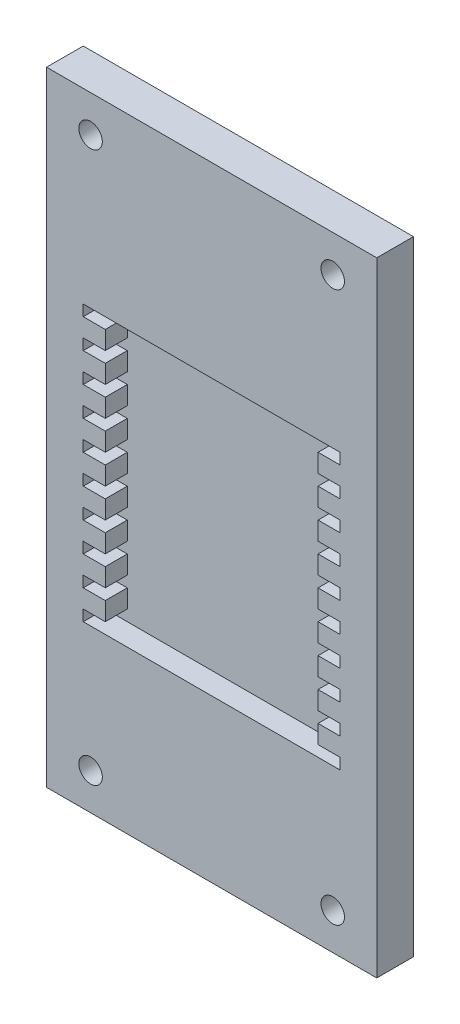
from build123d import *

# Parameters (mm, degrees)
SKIZZE1_W                       = 45
SKIZZE1_H                       = 85
AUFSATZ_LINEAR_AUSTRAGEN1_DEPTH = 5
SKIZZE6_R                       = 1.6
SCHNITT_LINEAR_AUSTRAGEN2_DEPTH = 3
SKIZZE7_W                       = 35
SKIZZE7_H                       = 1.5
SCHNITT_LINEAR_AUSTRAGEN3_DEPTH = 10
SKIZZE8_W                       = 29
SKIZZE8_H                       = 37.5
SCHNITT_LINEAR_AUSTRAGEN4_DEPTH = 10
SKIZZE9_W                       = 38.051320542
SKIZZE9_H                       = 40.768170305
AUFSATZ_LINEAR_AUSTRAGEN2_DEPTH = 2


with BuildPart() as part:
    # Skizze1 → Aufsatz-Linear austragen1 (new body)
    with BuildSketch(Plane.XY):
        with Locations((22.5, 42.5)):
            Rectangle(SKIZZE1_W, SKIZZE1_H)
    extrude(amount=AUFSATZ_LINEAR_AUSTRAGEN1_DEPTH)

    # Skizze6 → Schnitt-Linear austragen2 (cut)
    with BuildSketch(Plane.XY.offset(5)):
        with Locations((6, 80)):
            Circle(SKIZZE6_R)
        with Locations((39, 80)):
            Circle(SKIZZE6_R)
        with Locations((39, 5)):
            Circle(SKIZZE6_R)
        with Locations((6, 5)):
            Circle(SKIZZE6_R)
    extrude(amount=-SCHNITT_LINEAR_AUSTRAGEN2_DEPTH, mode=Mode.SUBTRACT)

    # Skizze7 → Schnitt-Linear austragen3 (cut)
    with BuildSketch(Plane.XY.offset(5)):
        with Locations((22.5, 58.8)):
            Rectangle(SKIZZE7_W, SKIZZE7_H)
        with Locations((22.5, 54.8)):
            Rectangle(SKIZZE7_W, SKIZZE7_H)
        with Locations((22.5, 50.8)):
            Rectangle(SKIZZE7_W, SKIZZE7_H)
        with Locations((22.5, 46.8)):
            Rectangle(SKIZZE7_W, SKIZZE7_H)
        with Locations((22.5, 42.8)):
            Rectangle(SKIZZE7_W, SKIZZE7_H)
        with Locations((22.5, 38.8)):
            Rectangle(SKIZZE7_W, SKIZZE7_H)
        with Locations((22.5, 34.8)):
            Rectangle(SKIZZE7_W, SKIZZE7_H)
        with Locations((22.5, 30.8)):
            Rectangle(SKIZZE7_W, SKIZZE7_H)
        with Locations((22.5, 26.8)):
            Rectangle(SKIZZE7_W, SKIZZE7_H)
        with Locations((22.5, 22.8)):
            Rectangle(SKIZZE7_W, SKIZZE7_H)
    extrude(amount=-SCHNITT_LINEAR_AUSTRAGEN3_DEPTH, mode=Mode.SUBTRACT)

    # Skizze8 → Schnitt-Linear austragen4 (cut)
    with BuildSketch(Plane.XY.offset(5)):
        with Locations((22.5, 40.8)):
            Rectangle(SKIZZE8_W, SKIZZE8_H)
    extrude(amount=-SCHNITT_LINEAR_AUSTRAGEN4_DEPTH, mode=Mode.SUBTRACT)

    # Skizze9 → Aufsatz-Linear austragen2 (add)
    with BuildSketch(Plane(origin=(0, 0, 0), x_dir=(-1, 0, 0), z_dir=(0, 0, -1))):
        with Locations((-22.316575494, 40.457263066)):
            Rectangle(SKIZZE9_W, SKIZZE9_H)
    extrude(amount=-AUFSATZ_LINEAR_AUSTRAGEN2_DEPTH)


solid = part.part
